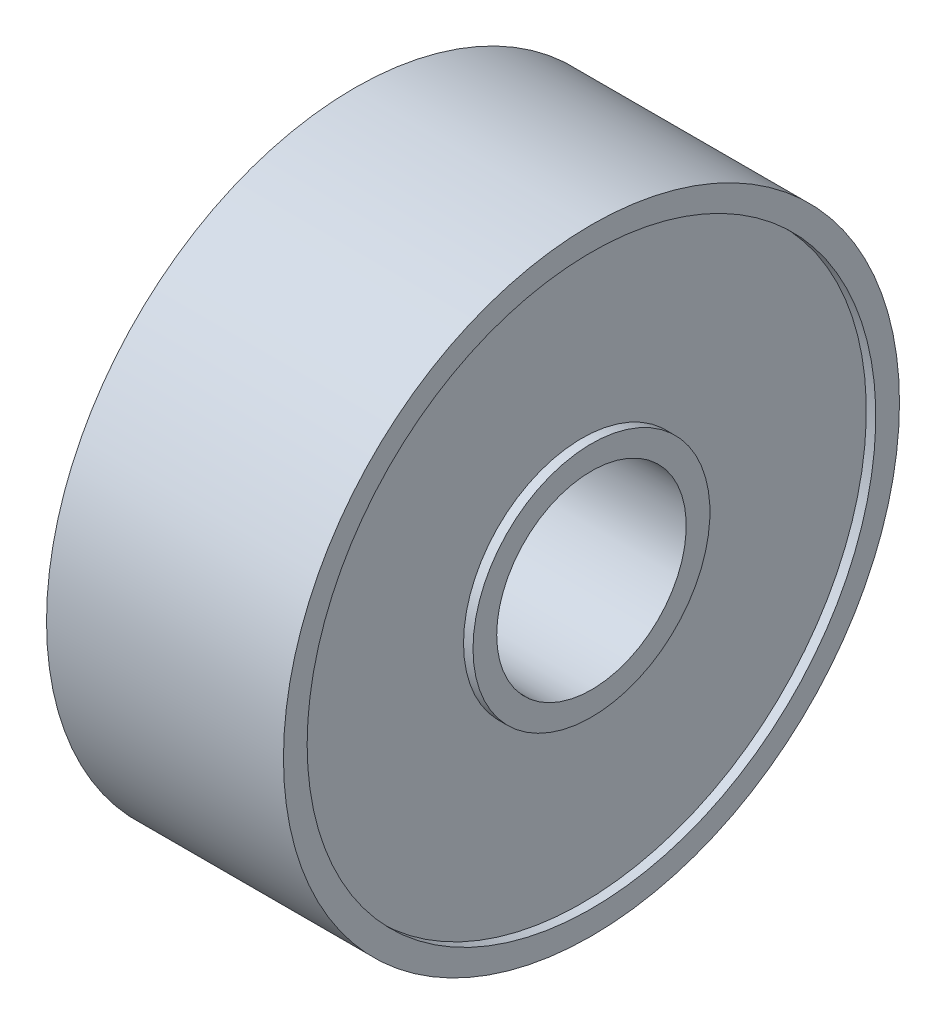
from build123d import *


with BuildPart() as part:
    # Esquisse1 → Révolution1 (revolve)
    with BuildSketch(Plane.XY):
        Polygon((-2.5, 2.5), (-2.3, 2.5), (-2.3, 6), (-2.5, 6), (-2.5, 6.5), (2.5, 6.5), (2.5, 6), (2.3, 6), (2.3, 2.5), (2.5, 2.5), (2.5, 2), (-2.5, 2), align=None)
    revolve(axis=Axis((-2.5, 0, 0), (1, 0, 0)))


solid = part.part
